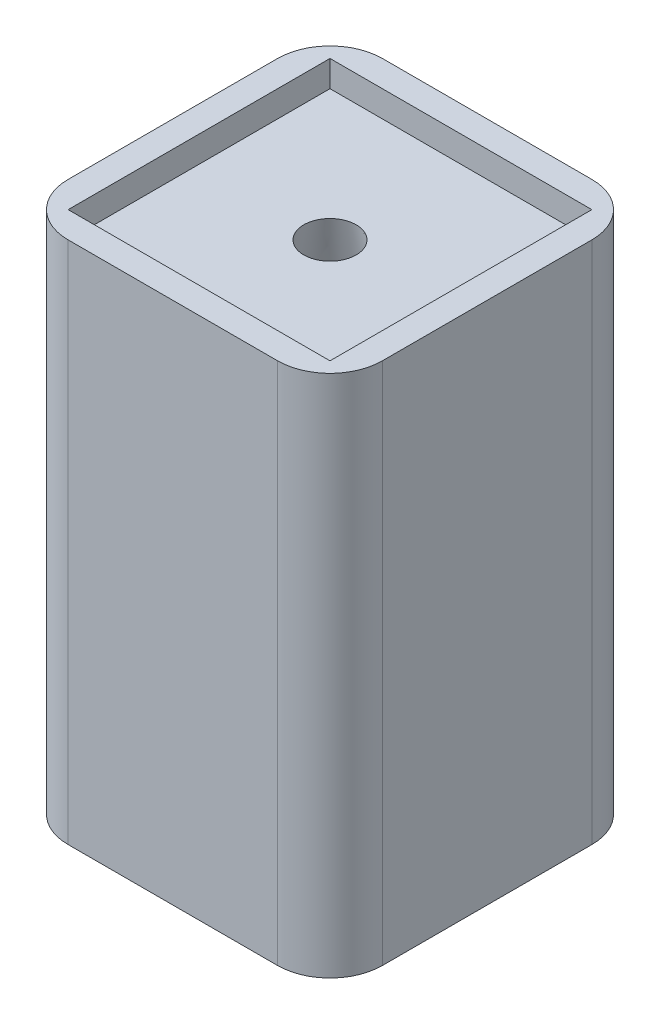
from build123d import *

# Parameters (mm, degrees)
SKETCH2_W           = 30
SKETCH2_H           = 30
BOSS_EXTRUDE1_DEPTH = 50
SKETCH3_W           = 25
SKETCH3_H           = 25
CUT_EXTRUDE1_DEPTH  = 2.5
FILLET1_R           = 5


with BuildPart() as part:
    # Sketch2 → Boss-Extrude1 (new body)
    with BuildSketch(Plane(origin=(0, 0, 0), x_dir=(1, 0, 0), z_dir=(0, 1, 0))):
        Rectangle(SKETCH2_W, SKETCH2_H)
    extrude(amount=BOSS_EXTRUDE1_DEPTH)

    # Sketch3 → Cut-Extrude1 (cut)
    with BuildSketch(Plane(origin=(0, 50, 0), x_dir=(1, 0, 0), z_dir=(0, 1, 0))):
        Rectangle(SKETCH3_W, SKETCH3_H)
    extrude(amount=-CUT_EXTRUDE1_DEPTH, mode=Mode.SUBTRACT)

    # Fillet1
    fillet1_edges = [part.edges().sort_by_distance(p)[0] for p in [
        (15, 25, 15),
        (-15, 25, 15),
        (-15, 25, -15),
        (15, 25, -15),
    ]]
    fillet(fillet1_edges, radius=FILLET1_R)

    # Cut-Loft2: read off the stored shape, not the designer's step
    # Cut-Loft2: loft between two sections, ruled curve by curve
    cut_loft2_from = [
        Edge.make_bspline([(0, 0, -12.5), (-25, 0, -12.5), (-25, 0, 12.5), (0, 0, 12.5), (25, 0, 12.5), (25, 0, -12.5), (0, 0, -12.5)], [0, 0, 0, 0, 0.5, 0.5, 0.5, 1, 1, 1, 1], 3, [1, 0.333333333, 0.333333333, 1, 0.333333333, 0.333333333, 1]),
    ]
    cut_loft2_to = [
        Edge.make_bspline([(0.784484005, 47.5, -2.373728048), (-3.962972092, 47.5, -3.942696057), (-5.531940101, 47.5, 0.804760039), (-0.784484005, 47.5, 2.373728048), (3.962972092, 47.5, 3.942696057), (5.531940101, 47.5, -0.804760039), (0.784484005, 47.5, -2.373728048)], [0, 0, 0, 0, 0.5, 0.5, 0.5, 1, 1, 1, 1], 3, [1, 0.333333333, 0.333333333, 1, 0.333333333, 0.333333333, 1]),
    ]
    cut_loft2 = Solid(Shell([*[Face.make_surface_from_curves(cut_loft2_from[k], cut_loft2_to[k]) for k in range(1)], Face(Wire(cut_loft2_from)), Face(Wire(cut_loft2_to))]))
    add(cut_loft2, mode=Mode.SUBTRACT)


solid = part.part
